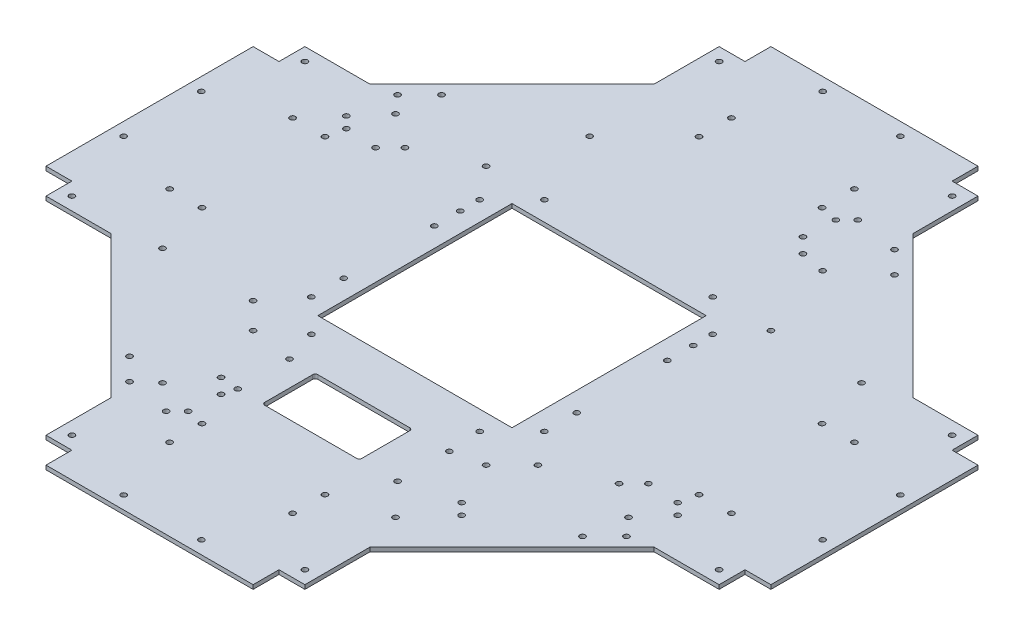
from build123d import *

# Parameters (mm, degrees)
SKETCH1_R           = 2.125
BOSS_EXTRUDE1_DEPTH = 3.175
SKETCH2_R           = 2.125
SKETCH2_R_2         = 2.1
SKETCH2_W           = 150
SKETCH2_H           = 150
SKETCH2_W_2         = 75
SKETCH2_H_2         = 41
CUT_EXTRUDE1_DEPTH  = 396.992525971
FILLET1_R           = 2
SKETCH3_W           = 20
SKETCH3_H           = 20
CUT_EXTRUDE2_DEPTH  = 396.992525971


with BuildPart() as part:
    # Sketch1 → Boss-Extrude1 (new body)
    with BuildSketch(Plane(origin=(0, 0, 0), x_dir=(1, 0, 0), z_dir=(0, 1, 0))):
        Polygon((-100, -280), (0, -280), (100, -280), (100, -209.601551084), (209.601551084, -100), (280, -100), (280, 0), (280, 100), (209.601551084, 100), (100, 209.601551084), (100, 280), (0, 280), (-100, 280), (-100, 209.601551084), (-209.601551084, 100), (-280, 100), (-280, 0), (-280, -100), (-209.601551084, -100), (-100, -209.601551084), align=None)
        with Locations((-90, -270)):
            Circle(SKETCH1_R, mode=Mode.SUBTRACT)
        with Locations((-90, -250)):
            Circle(SKETCH1_R, mode=Mode.SUBTRACT)
        with Locations((-30, -270)):
            Circle(SKETCH1_R, mode=Mode.SUBTRACT)
        with Locations((-47.5, -217)):
            Circle(SKETCH1_R, mode=Mode.SUBTRACT)
        with Locations((-90, -180)):
            Circle(SKETCH1_R, mode=Mode.SUBTRACT)
        with Locations((-47.5, -192)):
            Circle(SKETCH1_R, mode=Mode.SUBTRACT)
        with Locations((-270, -90)):
            Circle(SKETCH1_R, mode=Mode.SUBTRACT)
        with Locations((-250, -90)):
            Circle(SKETCH1_R, mode=Mode.SUBTRACT)
        with Locations((-180, -90)):
            Circle(SKETCH1_R, mode=Mode.SUBTRACT)
        with Locations((-217, -47.5)):
            Circle(SKETCH1_R, mode=Mode.SUBTRACT)
        with Locations((-270, -30)):
            Circle(SKETCH1_R, mode=Mode.SUBTRACT)
        with Locations((-192, -47.5)):
            Circle(SKETCH1_R, mode=Mode.SUBTRACT)
        with Locations((-90, -110)):
            Circle(SKETCH1_R, mode=Mode.SUBTRACT)
        with Locations((-110, -90)):
            Circle(SKETCH1_R, mode=Mode.SUBTRACT)
        with Locations((-90, -40)):
            Circle(SKETCH1_R, mode=Mode.SUBTRACT)
        with Locations((30, -270)):
            Circle(SKETCH1_R, mode=Mode.SUBTRACT)
        with Locations((47.5, -217)):
            Circle(SKETCH1_R, mode=Mode.SUBTRACT)
        with Locations((90, -270)):
            Circle(SKETCH1_R, mode=Mode.SUBTRACT)
        with Locations((90, -250)):
            Circle(SKETCH1_R, mode=Mode.SUBTRACT)
        with Locations((47.5, -192)):
            Circle(SKETCH1_R, mode=Mode.SUBTRACT)
        with Locations((90, -180)):
            Circle(SKETCH1_R, mode=Mode.SUBTRACT)
        with Locations((90, -110)):
            Circle(SKETCH1_R, mode=Mode.SUBTRACT)
        with Locations((110, -90)):
            Circle(SKETCH1_R, mode=Mode.SUBTRACT)
        with Locations((90, -40)):
            Circle(SKETCH1_R, mode=Mode.SUBTRACT)
        with Locations((180, -90)):
            Circle(SKETCH1_R, mode=Mode.SUBTRACT)
        with Locations((250, -90)):
            Circle(SKETCH1_R, mode=Mode.SUBTRACT)
        with Locations((270, -90)):
            Circle(SKETCH1_R, mode=Mode.SUBTRACT)
        with Locations((192, -47.5)):
            Circle(SKETCH1_R, mode=Mode.SUBTRACT)
        with Locations((217, -47.5)):
            Circle(SKETCH1_R, mode=Mode.SUBTRACT)
        with Locations((270, -30)):
            Circle(SKETCH1_R, mode=Mode.SUBTRACT)
        with Locations((-270, 30)):
            Circle(SKETCH1_R, mode=Mode.SUBTRACT)
        with Locations((-217, 47.5)):
            Circle(SKETCH1_R, mode=Mode.SUBTRACT)
        with Locations((-192, 47.5)):
            Circle(SKETCH1_R, mode=Mode.SUBTRACT)
        with Locations((-270, 90)):
            Circle(SKETCH1_R, mode=Mode.SUBTRACT)
        with Locations((-250, 90)):
            Circle(SKETCH1_R, mode=Mode.SUBTRACT)
        with Locations((-180, 90)):
            Circle(SKETCH1_R, mode=Mode.SUBTRACT)
        with Locations((-90, 30)):
            Circle(SKETCH1_R, mode=Mode.SUBTRACT)
        with Locations((-90, 50)):
            Circle(SKETCH1_R, mode=Mode.SUBTRACT)
        with Locations((-110, 90)):
            Circle(SKETCH1_R, mode=Mode.SUBTRACT)
        with Locations((-90, 150)):
            Circle(SKETCH1_R, mode=Mode.SUBTRACT)
        with Locations((-47.5, 192)):
            Circle(SKETCH1_R, mode=Mode.SUBTRACT)
        with Locations((-90, 250)):
            Circle(SKETCH1_R, mode=Mode.SUBTRACT)
        with Locations((-90, 270)):
            Circle(SKETCH1_R, mode=Mode.SUBTRACT)
        with Locations((-47.5, 217)):
            Circle(SKETCH1_R, mode=Mode.SUBTRACT)
        with Locations((-30, 270)):
            Circle(SKETCH1_R, mode=Mode.SUBTRACT)
        with Locations((90, 30)):
            Circle(SKETCH1_R, mode=Mode.SUBTRACT)
        with Locations((90, 50)):
            Circle(SKETCH1_R, mode=Mode.SUBTRACT)
        with Locations((110, 90)):
            Circle(SKETCH1_R, mode=Mode.SUBTRACT)
        with Locations((192, 47.5)):
            Circle(SKETCH1_R, mode=Mode.SUBTRACT)
        with Locations((270, 30)):
            Circle(SKETCH1_R, mode=Mode.SUBTRACT)
        with Locations((217, 47.5)):
            Circle(SKETCH1_R, mode=Mode.SUBTRACT)
        with Locations((180, 90)):
            Circle(SKETCH1_R, mode=Mode.SUBTRACT)
        with Locations((250, 90)):
            Circle(SKETCH1_R, mode=Mode.SUBTRACT)
        with Locations((270, 90)):
            Circle(SKETCH1_R, mode=Mode.SUBTRACT)
        with Locations((47.5, 192)):
            Circle(SKETCH1_R, mode=Mode.SUBTRACT)
        with Locations((90, 150)):
            Circle(SKETCH1_R, mode=Mode.SUBTRACT)
        with Locations((47.5, 217)):
            Circle(SKETCH1_R, mode=Mode.SUBTRACT)
        with Locations((30, 270)):
            Circle(SKETCH1_R, mode=Mode.SUBTRACT)
        with Locations((90, 250)):
            Circle(SKETCH1_R, mode=Mode.SUBTRACT)
        with Locations((90, 270)):
            Circle(SKETCH1_R, mode=Mode.SUBTRACT)
    extrude(amount=BOSS_EXTRUDE1_DEPTH)

    # Sketch2 → Cut-Extrude1 (cut, through all)
    with BuildSketch(Plane(origin=(0, 3.175, 0), x_dir=(1, 0, 0), z_dir=(0, 1, 0))):
        with Locations((66.6, -115)):
            Circle(SKETCH2_R)
        with Locations((-90, 65)):
            Circle(SKETCH2_R)
        with Locations((-90, -65)):
            Circle(SKETCH2_R)
        with Locations((90, -65)):
            Circle(SKETCH2_R)
        with Locations((90, 65)):
            Circle(SKETCH2_R)
        with Locations((-65, 90)):
            Circle(SKETCH2_R)
        with Locations((65, 90)):
            Circle(SKETCH2_R)
        with Locations((65, -90)):
            Circle(SKETCH2_R)
        with Locations((-65, -90)):
            Circle(SKETCH2_R)
        with Locations((66.6, -155)):
            Circle(SKETCH2_R)
        with Locations((-56.9, -115)):
            Circle(SKETCH2_R_2)
        with Locations((-56.9, -155)):
            Circle(SKETCH2_R_2)
        with Locations((174.953318806, -120.506096654)):
            Circle(SKETCH2_R)
        with Locations((191.923881554, -103.535533906)):
            Circle(SKETCH2_R)
        with Locations((153.736977236, -71.011760106)):
            Circle(SKETCH2_R)
        with Locations((165.050685735, -59.698051607)):
            Circle(SKETCH2_R)
        with Locations((-120.506096654, -174.953318806)):
            Circle(SKETCH2_R)
        with Locations((-103.535533906, -191.923881554)):
            Circle(SKETCH2_R)
        with Locations((-71.011760106, -153.736977236)):
            Circle(SKETCH2_R)
        with Locations((-59.698051607, -165.050685735)):
            Circle(SKETCH2_R)
        with Locations((-174.953318806, 120.506096654)):
            Circle(SKETCH2_R)
        with Locations((-191.923881554, 103.535533906)):
            Circle(SKETCH2_R)
        with Locations((-153.736977236, 71.011760106)):
            Circle(SKETCH2_R)
        with Locations((-165.050685735, 59.698051607)):
            Circle(SKETCH2_R)
        with Locations((120.506096654, 174.953318806)):
            Circle(SKETCH2_R)
        with Locations((103.535533906, 191.923881554)):
            Circle(SKETCH2_R)
        with Locations((71.011760106, 153.736977236)):
            Circle(SKETCH2_R)
        with Locations((59.698051607, 165.050685735)):
            Circle(SKETCH2_R)
        with Locations((114.142135624, -153.033008589)):
            Circle(SKETCH2_R)
        with Locations((105.656854249, -144.547727215)):
            Circle(SKETCH2_R_2)
        with Locations((197.580735804, -69.594408409)):
            Circle(SKETCH2_R)
        with Locations((189.09545443, -61.109127035)):
            Circle(SKETCH2_R_2)
        with Locations((-61.109127035, -189.09545443)):
            Circle(SKETCH2_R_2)
        with Locations((-69.594408409, -197.580735804)):
            Circle(SKETCH2_R)
        with Locations((-189.09545443, 61.109127035)):
            Circle(SKETCH2_R_2)
        with Locations((-197.580735804, 69.594408409)):
            Circle(SKETCH2_R)
        with Locations((61.109127035, 189.09545443)):
            Circle(SKETCH2_R_2)
        with Locations((69.594408409, 197.580735804)):
            Circle(SKETCH2_R)
        Rectangle(SKETCH2_W, SKETCH2_H)
        with Locations((0, -135)):
            Rectangle(SKETCH2_W_2, SKETCH2_H_2)
    extrude(amount=-CUT_EXTRUDE1_DEPTH, mode=Mode.SUBTRACT)

    # Fillet1
    fillet1_edges = [part.edges().sort_by_distance(p)[0] for p in [
        (-37.5, 1.5875, 155.5),
        (37.5, 1.5875, 155.5),
        (37.5, 1.5875, 114.5),
        (-37.5, 1.5875, 114.5),
    ]]
    fillet(fillet1_edges, radius=FILLET1_R)

    # Sketch3 → Cut-Extrude2 (cut, through all)
    with BuildSketch(Plane(origin=(0, 3.175, 0), x_dir=(1, 0, 0), z_dir=(0, 1, 0))):
        with Locations((-270, 90)):
            Rectangle(SKETCH3_W, SKETCH3_H)
        with Locations((90, -270)):
            Rectangle(SKETCH3_W, SKETCH3_H)
        with Locations((-90, -270)):
            Rectangle(SKETCH3_W, SKETCH3_H)
        with Locations((-270, -90)):
            Rectangle(SKETCH3_W, SKETCH3_H)
        with Locations((90, 270)):
            Rectangle(SKETCH3_W, SKETCH3_H)
        with Locations((-90, 270)):
            Rectangle(SKETCH3_W, SKETCH3_H)
        with Locations((270, -90)):
            Rectangle(SKETCH3_W, SKETCH3_H)
        with Locations((270, 90)):
            Rectangle(SKETCH3_W, SKETCH3_H)
    extrude(amount=-CUT_EXTRUDE2_DEPTH, mode=Mode.SUBTRACT)


solid = part.part
